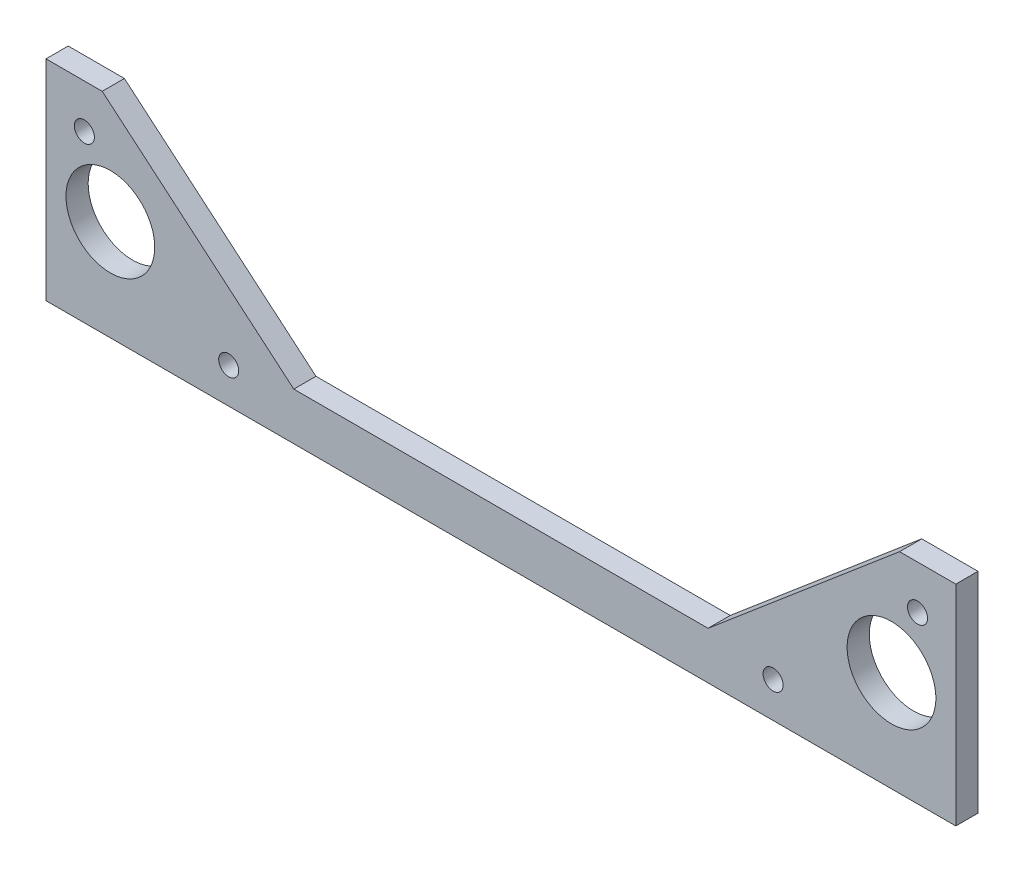
from build123d import *

# Parameters (mm, degrees)
SKETCH1_R             = 9.525
BOSS_EXTRUDE1_DEPTH   = 4.7625
F_6_CLEARANCE_HOLE1_D = 4.3053


with BuildPart() as part:
    # Sketch1 → Boss-Extrude1 (new body)
    with BuildSketch(Plane.XY):
        Polygon((-44.45, 10.16), (-85.56625, 44.958), (-97.63125, 44.958), (-97.63125, 0), (97.63125, 0), (97.63125, 44.958), (85.56625, 44.958), (44.45, 10.16), align=None)
        with Locations((-83.82, 21.59)):
            Circle(SKETCH1_R, mode=Mode.SUBTRACT)
        with Locations((83.82, 21.59)):
            Circle(SKETCH1_R, mode=Mode.SUBTRACT)
    extrude(amount=BOSS_EXTRUDE1_DEPTH)

    # #6 Clearance Hole1 (through all)
    with Locations(Plane.XY.offset(4.7625)):
        with Locations((89.408, 35.56), (58.42, 7.62), (-58.42, 7.62), (-89.408, 35.56)):
            Hole(F_6_CLEARANCE_HOLE1_D / 2)


solid = part.part
